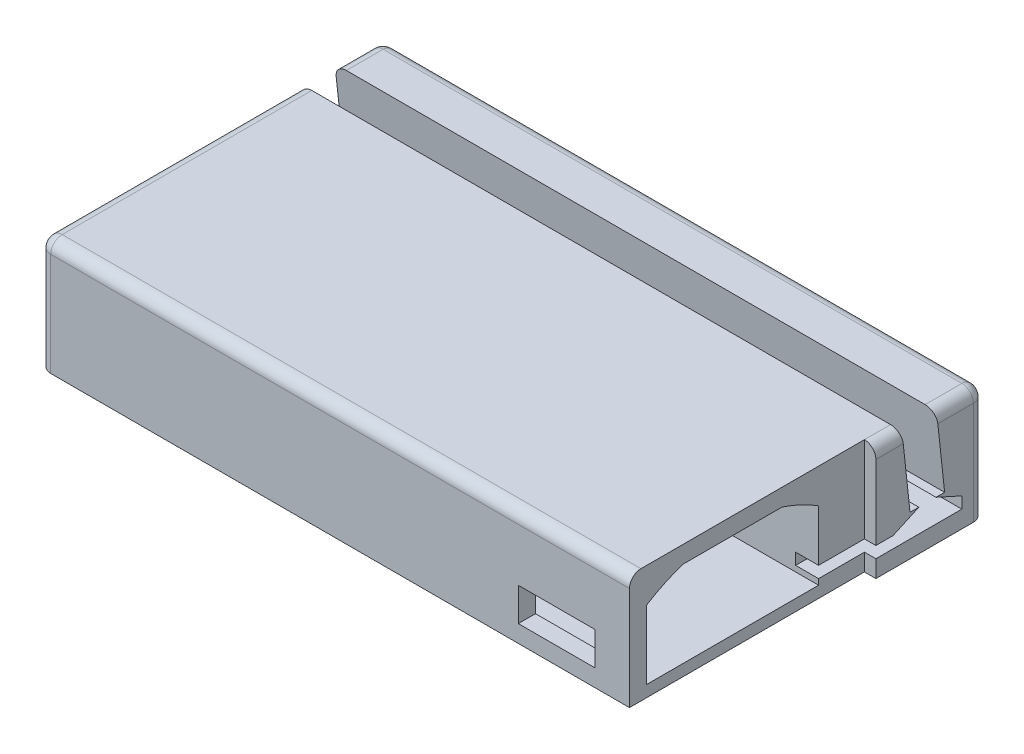
from build123d import *

# Parameters (mm, degrees)
P_IDAT_VYSUNUT_M2_DEPTH  = 105
SKICA3_W                 = 30
SKICA3_H                 = 12
ODEBRAT_VYSUNUT_M1_DEPTH = 102
SKICA5_W                 = 6
SKICA5_H                 = 2
ODEBRAT_VYSUNUT_M3_DEPTH = 15
ODEBRAT_VYSUNUT_M6_DEPTH = 102
SKICA12_W                = 41
SKICA12_H                = 20
ODEBRAT_VYSUNUT_M8_DEPTH = 2
SKICA13_W                = 13.4
SKICA13_H                = 5.8
ODEBRAT_VYSUNUT_M9_DEPTH = 10
ZAOBLIT1_R               = 2
ZAOBLIT2_R               = 2
ZKOSEN_2_SIZE            = 3


# Some blends are built 0.0001 mm under size
with BuildPart() as part:
    # Skica2 → Přidat vysunutím2 (new body)
    with BuildSketch(Plane(origin=(0, 0, 0), x_dir=(0, 0, -1), z_dir=(1, 0, 0))):
        Polygon((15.558367755, 10), (-30, 10), (-30, -10), (30, -10), (30, 10), (21.59358807, 10), (23, -2.961048892), (21.5, -2.961048892), (26, -5), (26, -7), (14, -7), (14, -5), (18.5, -2.961048892), (16.964779685, -2.961048892), align=None)
    extrude(amount=P_IDAT_VYSUNUT_M2_DEPTH)

    # Skica3 → Odebrat vysunutím1 (cut)
    with BuildSketch(Plane(origin=(105, 0, 0), x_dir=(0, 0, -1), z_dir=(1, 0, 0))):
        with Locations((-12, -2)):
            Rectangle(SKICA3_W, SKICA3_H)
    extrude(amount=-ODEBRAT_VYSUNUT_M1_DEPTH, mode=Mode.SUBTRACT)

    # Skica5 → Odebrat vysunutím3 (cut)
    with BuildSketch(Plane(origin=(0, 0, -14), x_dir=(-1, 0, 0), z_dir=(0, 0, -1))):
        with Locations((-102, -6)):
            Rectangle(SKICA5_W, SKICA5_H)
    extrude(amount=-ODEBRAT_VYSUNUT_M3_DEPTH, mode=Mode.SUBTRACT)

    # Skica10 → Odebrat vysunutím6 (cut)
    with BuildSketch(Plane(origin=(105, 0, 0), x_dir=(0, 0, -1), z_dir=(1, 0, 0))):
        with BuildLine():
            ThreePointArc((-20.610511889, 7), (-23.90017092, 5.702152702), (-27, 4))
            Line((-27, 4), (3, 4))
            ThreePointArc((3, 4), (-0.09982908, 5.702152702), (-3.389488111, 7))
            Line((-3.389488111, 7), (-20.610511889, 7))
        make_face()
    extrude(amount=-ODEBRAT_VYSUNUT_M6_DEPTH, mode=Mode.SUBTRACT)

    # Skica12 → Odebrat vysunutím8 (cut)
    with BuildSketch(Plane(origin=(105, 0, 0), x_dir=(0, 0, -1), z_dir=(1, 0, 0))):
        with Locations((-9.5, 0)):
            Rectangle(SKICA12_W, SKICA12_H)
    extrude(amount=-ODEBRAT_VYSUNUT_M8_DEPTH, mode=Mode.SUBTRACT)

    # Skica13 → Odebrat vysunutím9 (cut)
    with BuildSketch(Plane.XY.offset(30)):
        with Locations((90.3, -4.1)):
            Rectangle(SKICA13_W, SKICA13_H)
    extrude(amount=-ODEBRAT_VYSUNUT_M9_DEPTH, mode=Mode.SUBTRACT)

    # Zaoblit1
    zaoblit1_edges = [part.edges().sort_by_distance(p)[0] for p in [
        (0, 0, 30),
        (0, 10, 7.220816123),
        (105, 10, -13.279183877),
        (105, 10, -25.796794035),
        (0, 10, -25.796794035),
        (0, 0, -30),
        (52.5, 10, -30),
        (105, 0, -30),
    ]]
    fillet(zaoblit1_edges, radius=ZAOBLIT1_R)

    # Zaoblit2
    # the kernel refuses this fillet: 2 mm, written as the material it takes off along each edge
    with BuildSketch(Plane(origin=(2, 8, 28), x_dir=(0, 0, 1), z_dir=(0, 1, 0))) as zaoblit2_piece_1_section:
        Polygon((0, 0), (ZAOBLIT2_R, 0), (ZAOBLIT2_R, -ZAOBLIT2_R), (0, -ZAOBLIT2_R), align=None)
    zaoblit2_piece_1 = extrude(amount=ZAOBLIT2_R, mode=Mode.PRIVATE)
    zaoblit2_piece_1 = zaoblit2_piece_1 - Plane(origin=(2, 8, 28), x_dir=(0.7071067811865475, 0, -0.7071067811865475), z_dir=(0, 1, 0)) * Sphere(ZAOBLIT2_R, mode=Mode.PRIVATE)
    add(zaoblit2_piece_1, mode=Mode.SUBTRACT)
    with BuildSketch(Plane(origin=(2, 10, 30), x_dir=(0, 0, -1), z_dir=(1, 0, 0))) as zaoblit2_piece_2:
        with BuildLine():
            CenterArc((ZAOBLIT2_R, -ZAOBLIT2_R), ZAOBLIT2_R, 90, 90)
            Line((0, -ZAOBLIT2_R), (0, 0))
            Line((0, 0), (ZAOBLIT2_R, 0))
        make_face()
    extrude(amount=106, mode=Mode.SUBTRACT)

    # Zkosení2
    zkosen_2_edges = [part.edges().sort_by_distance(p)[0] for p in [
        (97, -4.1, 27),
    ]]
    chamfer(zkosen_2_edges, length=ZKOSEN_2_SIZE - 0.0001)  # a hair under: the kernel refuses the full size


solid = part.part
